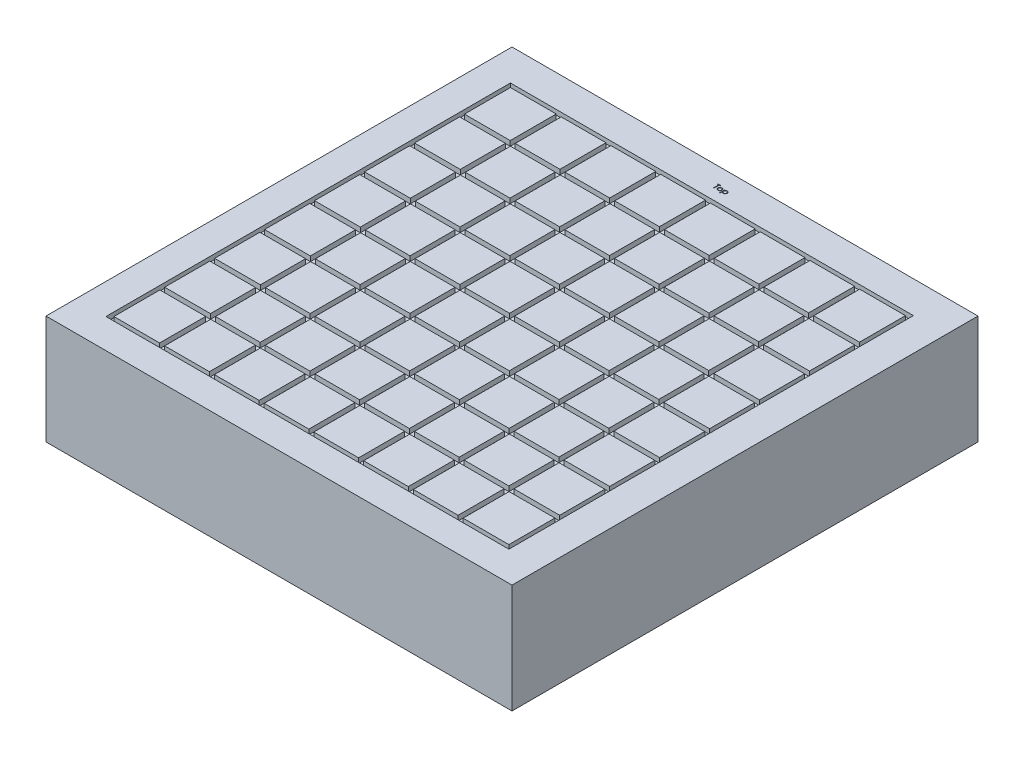
from build123d import *

# Parameters (mm, degrees)
SKETCH1_W                     = 298.45
SKETCH1_H                     = 298.45
BOSS_EXTRUDE1_DEPTH           = 69.85
CUT_EXTRUDE_THIN1_START       = -3.175
CUT_EXTRUDE_THIN1_OUTLINE_W   = 258.08
CUT_EXTRUDE_THIN1_OUTLINE_H   = 259.08
CUT_EXTRUDE_THIN1_OUTLINE_W_2 = 29.317142857
CUT_EXTRUDE_THIN1_OUTLINE_H_2 = 29.46
CUT_EXTRUDE_THIN1_OUTLINE_W_3 = 28.634285714
CUT_EXTRUDE_THIN1_OUTLINE_H_3 = 28.92
CUT_EXTRUDE_THIN1_OUTLINE_W_4 = 28.634285715
CUT_EXTRUDE_THIN1_DEPTH       = 3.175
CUT_EXTRUDE1_DEPTH            = 3.175


# Read off the part's stored shape, not the designer's step: Cut-Extrude-Thin1
with BuildPart() as part:
    # Sketch1 → Boss-Extrude1 (new body)
    with BuildSketch(Plane(origin=(0, 0, 0), x_dir=(1, 0, 0), z_dir=(0, 1, 0))):
        Rectangle(SKETCH1_W, SKETCH1_H)
    extrude(amount=BOSS_EXTRUDE1_DEPTH)

    # Cut-Extrude-Thin1 outline → Cut-Extrude-Thin1 (cut)
    with BuildSketch(Plane(origin=(0, 69.85, 0), x_dir=(1, 0, 0), z_dir=(0, 1, 0)).offset(CUT_EXTRUDE_THIN1_START)):
        with Locations((-0.725, -0.775)):
            Rectangle(CUT_EXTRUDE_THIN1_OUTLINE_W, CUT_EXTRUDE_THIN1_OUTLINE_H)
        with Locations((-112.566428572, -113.045)):
            Rectangle(CUT_EXTRUDE_THIN1_OUTLINE_W_2, CUT_EXTRUDE_THIN1_OUTLINE_H_2, mode=Mode.SUBTRACT)
        with Locations((-80.367857143, -113.045)):
            Rectangle(CUT_EXTRUDE_THIN1_OUTLINE_W_3, CUT_EXTRUDE_THIN1_OUTLINE_H_2, mode=Mode.SUBTRACT)
        with Locations((-112.566428572, -80.775)):
            Rectangle(CUT_EXTRUDE_THIN1_OUTLINE_W_2, CUT_EXTRUDE_THIN1_OUTLINE_H_3, mode=Mode.SUBTRACT)
        with Locations((-80.367857143, -80.775)):
            Rectangle(CUT_EXTRUDE_THIN1_OUTLINE_W_3, CUT_EXTRUDE_THIN1_OUTLINE_H_3, mode=Mode.SUBTRACT)
        with Locations((-48.510714286, -113.045)):
            Rectangle(CUT_EXTRUDE_THIN1_OUTLINE_W_3, CUT_EXTRUDE_THIN1_OUTLINE_H_2, mode=Mode.SUBTRACT)
        with Locations((-16.653571429, -113.045)):
            Rectangle(CUT_EXTRUDE_THIN1_OUTLINE_W_4, CUT_EXTRUDE_THIN1_OUTLINE_H_2, mode=Mode.SUBTRACT)
        with Locations((-48.510714286, -80.775)):
            Rectangle(CUT_EXTRUDE_THIN1_OUTLINE_W_3, CUT_EXTRUDE_THIN1_OUTLINE_H_3, mode=Mode.SUBTRACT)
        with Locations((-16.653571429, -80.775)):
            Rectangle(CUT_EXTRUDE_THIN1_OUTLINE_W_4, CUT_EXTRUDE_THIN1_OUTLINE_H_3, mode=Mode.SUBTRACT)
        with Locations((-112.566428572, -48.775)):
            Rectangle(CUT_EXTRUDE_THIN1_OUTLINE_W_2, CUT_EXTRUDE_THIN1_OUTLINE_H_3, mode=Mode.SUBTRACT)
        with Locations((-80.367857143, -48.775)):
            Rectangle(CUT_EXTRUDE_THIN1_OUTLINE_W_3, CUT_EXTRUDE_THIN1_OUTLINE_H_3, mode=Mode.SUBTRACT)
        with Locations((-112.566428572, -16.775)):
            Rectangle(CUT_EXTRUDE_THIN1_OUTLINE_W_2, CUT_EXTRUDE_THIN1_OUTLINE_H_3, mode=Mode.SUBTRACT)
        with Locations((-80.367857143, -16.775)):
            Rectangle(CUT_EXTRUDE_THIN1_OUTLINE_W_3, CUT_EXTRUDE_THIN1_OUTLINE_H_3, mode=Mode.SUBTRACT)
        with Locations((-48.510714286, -48.775)):
            Rectangle(CUT_EXTRUDE_THIN1_OUTLINE_W_3, CUT_EXTRUDE_THIN1_OUTLINE_H_3, mode=Mode.SUBTRACT)
        with Locations((-16.653571429, -48.775)):
            Rectangle(CUT_EXTRUDE_THIN1_OUTLINE_W_4, CUT_EXTRUDE_THIN1_OUTLINE_H_3, mode=Mode.SUBTRACT)
        with Locations((-48.510714286, -16.775)):
            Rectangle(CUT_EXTRUDE_THIN1_OUTLINE_W_3, CUT_EXTRUDE_THIN1_OUTLINE_H_3, mode=Mode.SUBTRACT)
        with Locations((-16.653571429, -16.775)):
            Rectangle(CUT_EXTRUDE_THIN1_OUTLINE_W_4, CUT_EXTRUDE_THIN1_OUTLINE_H_3, mode=Mode.SUBTRACT)
        with Locations((15.203571429, -113.045)):
            Rectangle(CUT_EXTRUDE_THIN1_OUTLINE_W_4, CUT_EXTRUDE_THIN1_OUTLINE_H_2, mode=Mode.SUBTRACT)
        with Locations((47.060714286, -113.045)):
            Rectangle(CUT_EXTRUDE_THIN1_OUTLINE_W_3, CUT_EXTRUDE_THIN1_OUTLINE_H_2, mode=Mode.SUBTRACT)
        with Locations((15.203571429, -80.775)):
            Rectangle(CUT_EXTRUDE_THIN1_OUTLINE_W_4, CUT_EXTRUDE_THIN1_OUTLINE_H_3, mode=Mode.SUBTRACT)
        with Locations((47.060714286, -80.775)):
            Rectangle(CUT_EXTRUDE_THIN1_OUTLINE_W_3, CUT_EXTRUDE_THIN1_OUTLINE_H_3, mode=Mode.SUBTRACT)
        with Locations((78.917857143, -113.045)):
            Rectangle(CUT_EXTRUDE_THIN1_OUTLINE_W_3, CUT_EXTRUDE_THIN1_OUTLINE_H_2, mode=Mode.SUBTRACT)
        with Locations((111.116428572, -113.045)):
            Rectangle(CUT_EXTRUDE_THIN1_OUTLINE_W_2, CUT_EXTRUDE_THIN1_OUTLINE_H_2, mode=Mode.SUBTRACT)
        with Locations((78.917857143, -80.775)):
            Rectangle(CUT_EXTRUDE_THIN1_OUTLINE_W_3, CUT_EXTRUDE_THIN1_OUTLINE_H_3, mode=Mode.SUBTRACT)
        with Locations((111.116428572, -80.775)):
            Rectangle(CUT_EXTRUDE_THIN1_OUTLINE_W_2, CUT_EXTRUDE_THIN1_OUTLINE_H_3, mode=Mode.SUBTRACT)
        with Locations((15.203571429, -48.775)):
            Rectangle(CUT_EXTRUDE_THIN1_OUTLINE_W_4, CUT_EXTRUDE_THIN1_OUTLINE_H_3, mode=Mode.SUBTRACT)
        with Locations((47.060714286, -48.775)):
            Rectangle(CUT_EXTRUDE_THIN1_OUTLINE_W_3, CUT_EXTRUDE_THIN1_OUTLINE_H_3, mode=Mode.SUBTRACT)
        with Locations((15.203571429, -16.775)):
            Rectangle(CUT_EXTRUDE_THIN1_OUTLINE_W_4, CUT_EXTRUDE_THIN1_OUTLINE_H_3, mode=Mode.SUBTRACT)
        with Locations((47.060714286, -16.775)):
            Rectangle(CUT_EXTRUDE_THIN1_OUTLINE_W_3, CUT_EXTRUDE_THIN1_OUTLINE_H_3, mode=Mode.SUBTRACT)
        with Locations((78.917857143, -48.775)):
            Rectangle(CUT_EXTRUDE_THIN1_OUTLINE_W_3, CUT_EXTRUDE_THIN1_OUTLINE_H_3, mode=Mode.SUBTRACT)
        with Locations((111.116428572, -48.775)):
            Rectangle(CUT_EXTRUDE_THIN1_OUTLINE_W_2, CUT_EXTRUDE_THIN1_OUTLINE_H_3, mode=Mode.SUBTRACT)
        with Locations((78.917857143, -16.775)):
            Rectangle(CUT_EXTRUDE_THIN1_OUTLINE_W_3, CUT_EXTRUDE_THIN1_OUTLINE_H_3, mode=Mode.SUBTRACT)
        with Locations((111.116428572, -16.775)):
            Rectangle(CUT_EXTRUDE_THIN1_OUTLINE_W_2, CUT_EXTRUDE_THIN1_OUTLINE_H_3, mode=Mode.SUBTRACT)
        with Locations((-112.566428572, 15.225)):
            Rectangle(CUT_EXTRUDE_THIN1_OUTLINE_W_2, CUT_EXTRUDE_THIN1_OUTLINE_H_3, mode=Mode.SUBTRACT)
        with Locations((-80.367857143, 15.225)):
            Rectangle(CUT_EXTRUDE_THIN1_OUTLINE_W_3, CUT_EXTRUDE_THIN1_OUTLINE_H_3, mode=Mode.SUBTRACT)
        with Locations((-112.566428572, 47.225)):
            Rectangle(CUT_EXTRUDE_THIN1_OUTLINE_W_2, CUT_EXTRUDE_THIN1_OUTLINE_H_3, mode=Mode.SUBTRACT)
        with Locations((-80.367857143, 47.225)):
            Rectangle(CUT_EXTRUDE_THIN1_OUTLINE_W_3, CUT_EXTRUDE_THIN1_OUTLINE_H_3, mode=Mode.SUBTRACT)
        with Locations((-48.510714286, 15.225)):
            Rectangle(CUT_EXTRUDE_THIN1_OUTLINE_W_3, CUT_EXTRUDE_THIN1_OUTLINE_H_3, mode=Mode.SUBTRACT)
        with Locations((-16.653571429, 15.225)):
            Rectangle(CUT_EXTRUDE_THIN1_OUTLINE_W_4, CUT_EXTRUDE_THIN1_OUTLINE_H_3, mode=Mode.SUBTRACT)
        with Locations((-48.510714286, 47.225)):
            Rectangle(CUT_EXTRUDE_THIN1_OUTLINE_W_3, CUT_EXTRUDE_THIN1_OUTLINE_H_3, mode=Mode.SUBTRACT)
        with Locations((-16.653571429, 47.225)):
            Rectangle(CUT_EXTRUDE_THIN1_OUTLINE_W_4, CUT_EXTRUDE_THIN1_OUTLINE_H_3, mode=Mode.SUBTRACT)
        with Locations((-112.566428572, 79.225)):
            Rectangle(CUT_EXTRUDE_THIN1_OUTLINE_W_2, CUT_EXTRUDE_THIN1_OUTLINE_H_3, mode=Mode.SUBTRACT)
        with Locations((-80.367857143, 79.225)):
            Rectangle(CUT_EXTRUDE_THIN1_OUTLINE_W_3, CUT_EXTRUDE_THIN1_OUTLINE_H_3, mode=Mode.SUBTRACT)
        with Locations((-112.566428572, 111.495)):
            Rectangle(CUT_EXTRUDE_THIN1_OUTLINE_W_2, CUT_EXTRUDE_THIN1_OUTLINE_H_2, mode=Mode.SUBTRACT)
        with Locations((-80.367857143, 111.495)):
            Rectangle(CUT_EXTRUDE_THIN1_OUTLINE_W_3, CUT_EXTRUDE_THIN1_OUTLINE_H_2, mode=Mode.SUBTRACT)
        with Locations((-48.510714286, 79.225)):
            Rectangle(CUT_EXTRUDE_THIN1_OUTLINE_W_3, CUT_EXTRUDE_THIN1_OUTLINE_H_3, mode=Mode.SUBTRACT)
        with Locations((-16.653571429, 79.225)):
            Rectangle(CUT_EXTRUDE_THIN1_OUTLINE_W_4, CUT_EXTRUDE_THIN1_OUTLINE_H_3, mode=Mode.SUBTRACT)
        with Locations((-48.510714286, 111.495)):
            Rectangle(CUT_EXTRUDE_THIN1_OUTLINE_W_3, CUT_EXTRUDE_THIN1_OUTLINE_H_2, mode=Mode.SUBTRACT)
        with Locations((-16.653571429, 111.495)):
            Rectangle(CUT_EXTRUDE_THIN1_OUTLINE_W_4, CUT_EXTRUDE_THIN1_OUTLINE_H_2, mode=Mode.SUBTRACT)
        with Locations((15.203571429, 15.225)):
            Rectangle(CUT_EXTRUDE_THIN1_OUTLINE_W_4, CUT_EXTRUDE_THIN1_OUTLINE_H_3, mode=Mode.SUBTRACT)
        with Locations((47.060714286, 15.225)):
            Rectangle(CUT_EXTRUDE_THIN1_OUTLINE_W_3, CUT_EXTRUDE_THIN1_OUTLINE_H_3, mode=Mode.SUBTRACT)
        with Locations((15.203571429, 47.225)):
            Rectangle(CUT_EXTRUDE_THIN1_OUTLINE_W_4, CUT_EXTRUDE_THIN1_OUTLINE_H_3, mode=Mode.SUBTRACT)
        with Locations((47.060714286, 47.225)):
            Rectangle(CUT_EXTRUDE_THIN1_OUTLINE_W_3, CUT_EXTRUDE_THIN1_OUTLINE_H_3, mode=Mode.SUBTRACT)
        with Locations((78.917857143, 15.225)):
            Rectangle(CUT_EXTRUDE_THIN1_OUTLINE_W_3, CUT_EXTRUDE_THIN1_OUTLINE_H_3, mode=Mode.SUBTRACT)
        with Locations((111.116428572, 15.225)):
            Rectangle(CUT_EXTRUDE_THIN1_OUTLINE_W_2, CUT_EXTRUDE_THIN1_OUTLINE_H_3, mode=Mode.SUBTRACT)
        with Locations((78.917857143, 47.225)):
            Rectangle(CUT_EXTRUDE_THIN1_OUTLINE_W_3, CUT_EXTRUDE_THIN1_OUTLINE_H_3, mode=Mode.SUBTRACT)
        with Locations((111.116428572, 47.225)):
            Rectangle(CUT_EXTRUDE_THIN1_OUTLINE_W_2, CUT_EXTRUDE_THIN1_OUTLINE_H_3, mode=Mode.SUBTRACT)
        with Locations((15.203571429, 79.225)):
            Rectangle(CUT_EXTRUDE_THIN1_OUTLINE_W_4, CUT_EXTRUDE_THIN1_OUTLINE_H_3, mode=Mode.SUBTRACT)
        with Locations((47.060714286, 79.225)):
            Rectangle(CUT_EXTRUDE_THIN1_OUTLINE_W_3, CUT_EXTRUDE_THIN1_OUTLINE_H_3, mode=Mode.SUBTRACT)
        with Locations((15.203571429, 111.495)):
            Rectangle(CUT_EXTRUDE_THIN1_OUTLINE_W_4, CUT_EXTRUDE_THIN1_OUTLINE_H_2, mode=Mode.SUBTRACT)
        with Locations((47.060714286, 111.495)):
            Rectangle(CUT_EXTRUDE_THIN1_OUTLINE_W_3, CUT_EXTRUDE_THIN1_OUTLINE_H_2, mode=Mode.SUBTRACT)
        with Locations((78.917857143, 79.225)):
            Rectangle(CUT_EXTRUDE_THIN1_OUTLINE_W_3, CUT_EXTRUDE_THIN1_OUTLINE_H_3, mode=Mode.SUBTRACT)
        with Locations((111.116428572, 79.225)):
            Rectangle(CUT_EXTRUDE_THIN1_OUTLINE_W_2, CUT_EXTRUDE_THIN1_OUTLINE_H_3, mode=Mode.SUBTRACT)
        with Locations((78.917857143, 111.495)):
            Rectangle(CUT_EXTRUDE_THIN1_OUTLINE_W_3, CUT_EXTRUDE_THIN1_OUTLINE_H_2, mode=Mode.SUBTRACT)
        with Locations((111.116428572, 111.495)):
            Rectangle(CUT_EXTRUDE_THIN1_OUTLINE_W_2, CUT_EXTRUDE_THIN1_OUTLINE_H_2, mode=Mode.SUBTRACT)
    extrude(amount=CUT_EXTRUDE_THIN1_DEPTH, mode=Mode.SUBTRACT)

    # Sketch4 → Cut-Extrude1 (cut)
    # profile 1 of 3: a face of its own
    with BuildSketch(Plane(origin=(0, 69.85, 0), x_dir=(1, 0, 0), z_dir=(0, 1, 0))):
        Polygon((-7.33208401, 138.867429062), (-7.33208401, 139.226403421), (-5.49234042, 139.226403421), (-5.49234042, 138.867429062), (-6.255160933, 138.867429062), (-6.255160933, 135.726403421), (-6.569263497, 135.726403421), (-6.569263497, 138.867429062), align=None)
    # profile 2 of 3: a face of its own
    with BuildSketch(Plane(origin=(0, 69.85, 0), x_dir=(1, 0, 0), z_dir=(0, 1, 0))):
        with BuildLine():
            add(Edge.make_bspline(
                [(-3.808245868, 138.328967523), (-3.760254596, 138.327945632), (-3.666155438, 138.325941953), (-3.528347552, 138.304526988), (-3.396802416, 138.271779623), (-3.271016224, 138.226508061), (-3.152599929, 138.165826111), (-3.039828685, 138.09341682), (-2.933011676, 138.007634226), (-2.868988646, 137.941276158), (-2.836491061, 137.907593325)],
                knots=[0, 0, 0, 0, 1.054011418, 2.066658804, 3.057071809, 4.030435133, 4.997543892, 5.974964718, 6.972108034, 8, 8, 8, 8], degree=3))
            add(Edge.make_bspline(
                [(-2.836491061, 137.907593325), (-2.808509107, 137.875379339), (-2.753086726, 137.811574797), (-2.682021008, 137.708119184), (-2.620799448, 137.600979083), (-2.571736487, 137.488731756), (-2.533051463, 137.372357085), (-2.505585767, 137.251455074), (-2.489248832, 137.126292727), (-2.487045865, 137.041288889), (-2.485930163, 136.998238357)],
                knots=[0, 0, 0, 0, 1.025258237, 2.030674902, 3.01204498, 3.988269485, 4.97094183, 5.956517959, 6.965070386, 8, 8, 8, 8], degree=3))
            add(Edge.make_bspline(
                [(-2.485930163, 136.998238357), (-2.486911501, 136.954938299), (-2.488850669, 136.869375366), (-2.507194285, 136.743356), (-2.535725371, 136.621161177), (-2.576557209, 136.503302483), (-2.628915319, 136.389419656), (-2.692806006, 136.280010107), (-2.768677623, 136.174857974), (-2.85468162, 136.074856135), (-2.949733496, 135.98268992), (-3.052849645, 135.902361651), (-3.162003678, 135.833540127), (-3.278647032, 135.778103711), (-3.401714518, 135.734394011), (-3.531471587, 135.703693994), (-3.667716657, 135.68513231), (-3.760743878, 135.682748737), (-3.808245868, 135.681531626)],
                knots=[0, 0, 0, 0, 0.998656419, 1.973391657, 2.932242238, 3.890759089, 4.846373663, 5.82037756, 6.809684879, 7.83454468, 8.860553229, 9.859544525, 10.845671541, 11.83227036, 12.833544569, 13.85385346, 14.904124723, 16, 16, 16, 16], degree=3))
            add(Edge.make_bspline(
                [(-3.808245868, 135.681531626), (-3.855980588, 135.682752822), (-3.949471448, 135.685144597), (-4.08619743, 135.703621879), (-4.216187049, 135.734379862), (-4.339415647, 135.778247355), (-4.456560494, 135.833541898), (-4.566346991, 135.902153588), (-4.669546907, 135.982713743), (-4.764618891, 136.07484968), (-4.850617496, 136.174859637), (-4.926490505, 136.280009675), (-4.990380831, 136.389419769), (-5.042739035, 136.503302453), (-5.083570848, 136.621161185), (-5.11210194, 136.743355998), (-5.130445555, 136.869375366), (-5.132384723, 136.954938299), (-5.133366061, 136.998238357)],
                knots=[0, 0, 0, 0, 1.099876186, 2.154163076, 3.173186993, 4.173200201, 5.163417411, 6.152872554, 7.150605724, 8.17532212, 9.198891216, 10.186952605, 11.159729845, 12.11414092, 13.071450619, 14.029093627, 15.002601286, 16, 16, 16, 16], degree=3))
            add(Edge.make_bspline(
                [(-5.133366061, 136.998238357), (-5.13224275, 137.041054903), (-5.130018789, 137.125824305), (-5.11369828, 137.250751366), (-5.086339723, 137.371448755), (-5.047608327, 137.487374231), (-4.998093136, 137.599129667), (-4.937731848, 137.706534498), (-4.865941216, 137.809522298), (-4.810739264, 137.873244378), (-4.782805163, 137.905489959)],
                knots=[0, 0, 0, 0, 1.031353054, 2.041901799, 3.029428768, 4.008703097, 4.981709435, 5.96992636, 6.972712378, 8, 8, 8, 8], degree=3))
            add(Edge.make_bspline(
                [(-4.782805163, 137.905489959), (-4.750356572, 137.939464899), (-4.686540708, 138.006282595), (-4.579191981, 138.091815119), (-4.46669816, 138.165731193), (-4.346973234, 138.225207408), (-4.221290376, 138.272045926), (-4.089071133, 138.304611441), (-3.950795618, 138.325864796), (-3.856235996, 138.327922974), (-3.808245868, 138.328967523)],
                knots=[0, 0, 0, 0, 1.027980169, 2.021703884, 2.998553061, 3.971491411, 4.943284454, 5.930300938, 6.949603206, 8, 8, 8, 8], degree=3))
        make_face()
        with BuildLine():
            add(Edge.make_bspline(
                [(-3.809648112, 138.014864959), (-3.843585723, 138.013900368), (-3.910584852, 138.011996085), (-4.009204437, 137.99751218), (-4.104144591, 137.974564676), (-4.195585435, 137.94196062), (-4.283218607, 137.899861721), (-4.36712801, 137.848153361), (-4.44756045, 137.787520404), (-4.522942513, 137.718057733), (-4.592124825, 137.642178738), (-4.652602802, 137.561330379), (-4.704027908, 137.476824033), (-4.746868067, 137.388571822), (-4.778775255, 137.295679408), (-4.801948278, 137.199198777), (-4.816418518, 137.09893336), (-4.818304897, 137.030772342), (-4.819263497, 136.996134991)],
                knots=[0, 0, 0, 0, 1.021534396, 2.016698045, 2.994645724, 3.958388632, 4.93408049, 5.916473867, 6.921342795, 7.962252576, 8.998418191, 10.008913653, 10.997312074, 11.973003931, 12.956656626, 13.948281152, 14.957379055, 16, 16, 16, 16], degree=3))
            add(Edge.make_bspline(
                [(-4.819263497, 136.996134991), (-4.817656673, 136.951382964), (-4.814467429, 136.862558559), (-4.788532192, 136.731747436), (-4.745145912, 136.606165584), (-4.686558633, 136.486549198), (-4.613152414, 136.37587692), (-4.526665347, 136.277205435), (-4.428025647, 136.192019624), (-4.318409147, 136.121338778), (-4.200054829, 136.065179023), (-4.074798508, 136.025380047), (-3.944157814, 135.999508355), (-3.854877082, 135.99693688), (-3.809648112, 135.99563419)],
                knots=[0, 0, 0, 0, 1.016792936, 2.018143844, 3.017858371, 4.030088057, 5.03801393, 6.028138512, 7.003788237, 7.991172063, 8.984598303, 9.972568034, 10.972917682, 12, 12, 12, 12], degree=3))
            add(Edge.make_bspline(
                [(-3.809648112, 135.99563419), (-3.764421743, 135.99694447), (-3.675146147, 135.999530927), (-3.54468697, 136.025249747), (-3.419772998, 136.065353408), (-3.301541611, 136.121275617), (-3.191975008, 136.192288032), (-3.092625886, 136.276724409), (-3.006877275, 136.376138261), (-2.93354367, 136.486695789), (-2.873996927, 136.605980142), (-2.830813726, 136.731770614), (-2.80481614, 136.862552656), (-2.801635311, 136.951380987), (-2.800032727, 136.996134991)],
                knots=[0, 0, 0, 0, 1.02726834, 2.027799167, 3.010890988, 4.004497153, 4.992059811, 5.971914811, 6.958719428, 7.966827853, 8.981595046, 9.981490638, 10.983022906, 12, 12, 12, 12], degree=3))
            add(Edge.make_bspline(
                [(-2.800032727, 136.996134991), (-2.800990997, 137.030772549), (-2.802876727, 137.098933975), (-2.817351691, 137.199196428), (-2.840507231, 137.295688025), (-2.872478848, 137.388540028), (-2.915132862, 137.477052533), (-2.967549655, 137.56108226), (-3.02778068, 137.642458806), (-3.097797801, 137.717812446), (-3.173101179, 137.787547483), (-3.253566217, 137.848176872), (-3.337351196, 137.899634468), (-3.424729778, 137.942320708), (-3.516182346, 137.974268049), (-3.610989475, 137.99764468), (-3.709188285, 138.011934877), (-3.775947328, 138.013882018), (-3.809648112, 138.014864959)],
                knots=[0, 0, 0, 0, 1.042956736, 2.052379634, 3.044323526, 4.02829302, 5.004299113, 5.996692471, 7.007513377, 8.048758398, 9.090003419, 10.095195979, 11.07790575, 12.047570684, 13.018257071, 13.989683339, 14.985167495, 16, 16, 16, 16], degree=3))
        make_face(mode=Mode.SUBTRACT)
    # profile 3 of 3: a face of its own
    with BuildSketch(Plane(origin=(0, 69.85, 0), x_dir=(1, 0, 0), z_dir=(0, 1, 0))):
        with BuildLine():
            Line((-1.857725035, 138.284095729), (-1.543622471, 138.284095729))
            Line((-1.543622471, 138.284095729), (-1.543622471, 137.810838517))
            add(Edge.make_bspline(
                [(-1.543622471, 137.810838517), (-1.510264987, 137.853776251), (-1.445441392, 137.937217144), (-1.333716487, 138.045207272), (-1.215789679, 138.136282576), (-1.088626266, 138.207665109), (-0.954202576, 138.261485921), (-0.813070259, 138.301265371), (-0.664031494, 138.324706845), (-0.562135041, 138.327528507), (-0.510168945, 138.328967523)],
                knots=[0, 0, 0, 0, 1.0828784, 2.104357462, 3.088488658, 4.04616522, 5.001424249, 5.969181776, 6.964304535, 8, 8, 8, 8], degree=3))
            add(Edge.make_bspline(
                [(-0.510168945, 138.328967523), (-0.464777342, 138.327654344), (-0.375058454, 138.325058777), (-0.242995225, 138.307485723), (-0.115819841, 138.27736803), (0.005748213, 138.233967115), (0.123011278, 138.180311645), (0.234233378, 138.11259461), (0.341146933, 138.034188419), (0.441063122, 137.943956268), (0.53338449, 137.846328002), (0.613230671, 137.741305697), (0.682102575, 137.632343111), (0.737772872, 137.517751019), (0.781381219, 137.398431789), (0.812395897, 137.273903348), (0.83085354, 137.144627408), (0.833329992, 137.056724687), (0.834582657, 137.012260793)],
                knots=[0, 0, 0, 0, 1.041296284, 2.058176809, 3.050446431, 4.034000596, 5.01514041, 6.003636468, 7.015969324, 8.052561599, 9.08815499, 10.094063707, 11.074456064, 12.040834395, 13.011057502, 13.983766392, 14.980127149, 16, 16, 16, 16], degree=3))
            add(Edge.make_bspline(
                [(0.834582657, 137.012260793), (0.833357172, 136.966858484), (0.830940337, 136.87731858), (0.812195331, 136.745831482), (0.782238457, 136.619344109), (0.739180274, 136.498066845), (0.683538786, 136.382083194), (0.615834225, 136.271476798), (0.535947758, 136.166283094), (0.44464663, 136.067930194), (0.345593694, 135.977330881), (0.239716205, 135.898092812), (0.128657279, 135.831551437), (0.012985112, 135.775968477), (-0.108290526, 135.734076293), (-0.234603804, 135.703858492), (-0.36588595, 135.685223997), (-0.455187102, 135.682771854), (-0.50035324, 135.681531626)],
                knots=[0, 0, 0, 0, 1.038740735, 2.04854663, 3.033179607, 4.009277356, 4.987731542, 5.972001279, 6.972200261, 8.005528982, 9.039189865, 10.040446548, 11.026516639, 11.997840187, 12.972163198, 13.956796175, 14.96660207, 16, 16, 16, 16], degree=3))
            add(Edge.make_bspline(
                [(-0.50035324, 135.681531626), (-0.551180812, 135.682826434), (-0.651580168, 135.685384059), (-0.798377839, 135.711303469), (-0.939654691, 135.750040404), (-1.073845515, 135.806739398), (-1.202013328, 135.878994914), (-1.323433134, 135.96710512), (-1.438749887, 136.070885744), (-1.508158644, 136.149617561), (-1.543622471, 136.189844927)],
                knots=[0, 0, 0, 0, 1.014726462, 2.004382257, 2.969841629, 3.936926163, 4.907207904, 5.903978561, 6.929055279, 8, 8, 8, 8], degree=3))
            Line((-1.543622471, 136.189844927), (-1.543622471, 134.784095729))
            Line((-1.543622471, 134.784095729), (-1.857725035, 134.784095729))
            Line((-1.857725035, 134.784095729), (-1.857725035, 138.284095729))
        make_face()
        with BuildLine():
            add(Edge.make_bspline(
                [(-0.512973433, 138.014864959), (-0.548552995, 138.014224701), (-0.618599983, 138.012964198), (-0.721272202, 137.997990249), (-0.82016763, 137.976252508), (-0.914289581, 137.943340607), (-1.004540197, 137.902941794), (-1.090224362, 137.852459783), (-1.17128193, 137.792807777), (-1.24750896, 137.725128433), (-1.316372254, 137.650553745), (-1.377335182, 137.570965936), (-1.428542487, 137.486465796), (-1.471044507, 137.397840434), (-1.50338779, 137.304395149), (-1.526343509, 137.206662136), (-1.540773862, 137.104534424), (-1.5426628, 137.034978417), (-1.543622471, 136.9996406)],
                knots=[0, 0, 0, 0, 1.05670511, 2.080379991, 3.077984906, 4.06214886, 5.038337365, 6.01289324, 7.01187578, 8.025460281, 9.038092164, 10.024533457, 11.000252242, 11.969694649, 12.940728589, 13.933144304, 14.949937299, 16, 16, 16, 16], degree=3))
            add(Edge.make_bspline(
                [(-1.543622471, 136.9996406), (-1.542031615, 136.953252488), (-1.538914993, 136.862374247), (-1.513577625, 136.729590125), (-1.472342361, 136.603938469), (-1.413813647, 136.486477432), (-1.339866073, 136.378494597), (-1.250767917, 136.281803991), (-1.147325366, 136.1970134), (-1.031258174, 136.125592146), (-0.906836043, 136.067604079), (-0.777050131, 136.026089869), (-0.64368525, 136.000517641), (-0.553516931, 135.997270822), (-0.50806558, 135.99563419)],
                knots=[0, 0, 0, 0, 1.03728447, 2.032128127, 3.01272805, 3.987917167, 4.958271349, 5.931593992, 6.91984656, 7.941419022, 8.973179163, 9.983609215, 10.983593296, 12, 12, 12, 12], degree=3))
            add(Edge.make_bspline(
                [(-0.50806558, 135.99563419), (-0.463529812, 135.997190567), (-0.375134319, 136.000279695), (-0.244976198, 136.027017883), (-0.118485559, 136.067862907), (0.001694613, 136.127422464), (0.114518101, 136.200412522), (0.216399655, 136.287972555), (0.305406568, 136.389462498), (0.381270923, 136.502471001), (0.442402409, 136.623646385), (0.488332648, 136.749027773), (0.514841222, 136.878173196), (0.51859801, 136.965170909), (0.520480093, 137.008755184)],
                knots=[0, 0, 0, 0, 1.00104056, 1.986885549, 2.97790532, 3.984399681, 4.995088187, 5.994304198, 6.996462723, 8.023150851, 9.048424203, 10.043036403, 11.019596776, 12, 12, 12, 12], degree=3))
            add(Edge.make_bspline(
                [(0.520480093, 137.008755184), (0.519025359, 137.052610173), (0.516127225, 137.139978476), (0.487580188, 137.268741379), (0.44468021, 137.394629355), (0.382121158, 137.514149905), (0.307919889, 137.626923988), (0.218172892, 137.726477867), (0.117556695, 137.81364854), (0.004867531, 137.885663949), (-0.116072894, 137.942949444), (-0.24338781, 137.984833083), (-0.376431413, 138.010006833), (-0.467059067, 138.013231339), (-0.512973433, 138.014864959)],
                knots=[0, 0, 0, 0, 0.983928682, 1.960191568, 2.949917689, 3.96440592, 4.982380491, 5.975291189, 6.965713506, 7.964880129, 8.970154049, 9.96478489, 10.968906225, 12, 12, 12, 12], degree=3))
        make_face(mode=Mode.SUBTRACT)
    extrude(amount=-CUT_EXTRUDE1_DEPTH, mode=Mode.SUBTRACT)


solid = part.part
